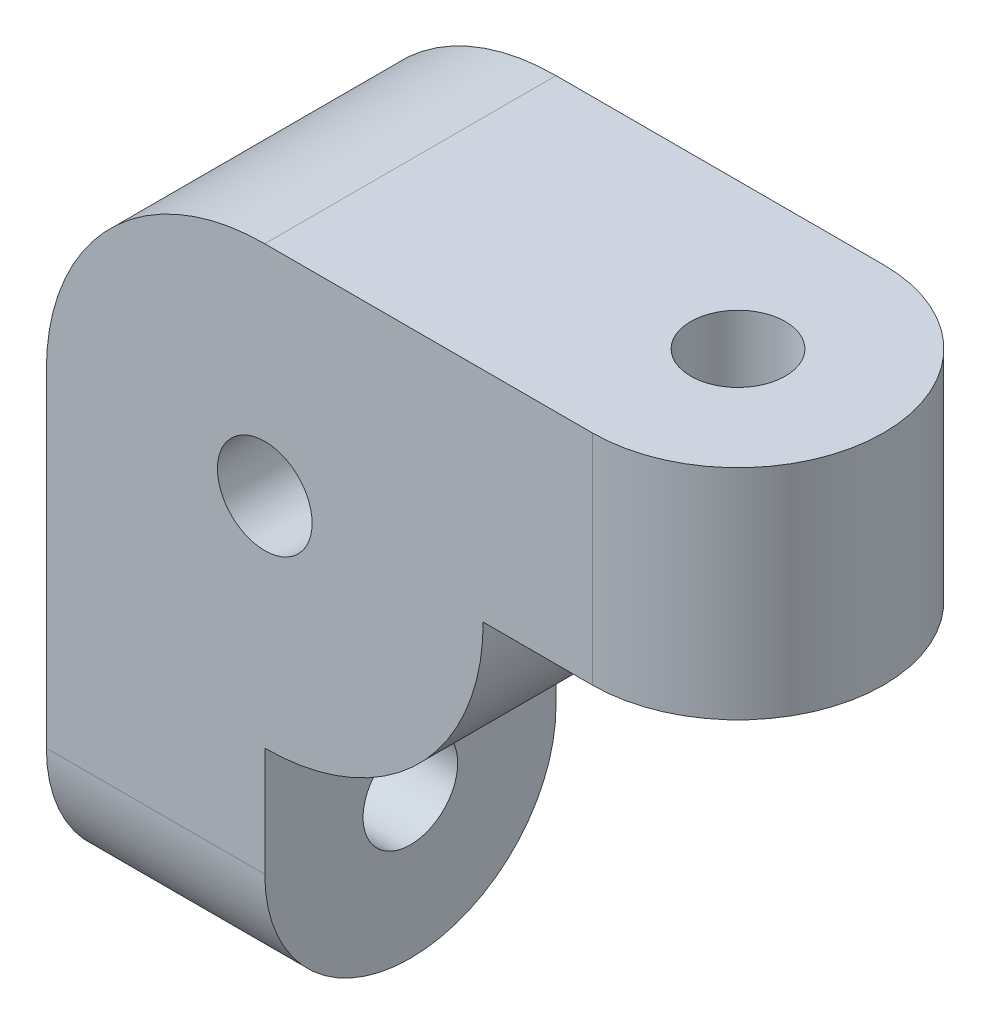
from build123d import *

# Parameters (mm, degrees)
SKETCH1_R           = 1.3
BOSS_EXTRUDE1_DEPTH = 8
BOSS_EXTRUDE2_DEPTH = 6
BOSS_EXTRUDE4_DEPTH = 6
SKETCH12_R          = 1.3
CUT_EXTRUDE6_DEPTH  = 6
SKETCH13_R          = 1.3
CUT_EXTRUDE7_DEPTH  = 6
SKETCH14_R          = 3
CUT_EXTRUDE8_DEPTH  = 3


with BuildPart() as part:
    # Sketch1 → Boss-Extrude1 (new body)
    with BuildSketch(Plane.XY):
        with BuildLine():
            Line((-6, -6), (0, -6))
            ThreePointArc((0, -6), (4.242640687, -4.242640687), (6, 0))
            Line((6, 0), (6, 6))
            Line((6, 6), (0, 6))
            ThreePointArc((0, 6), (-4.242640687, 4.242640687), (-6, 0))
            Line((-6, 0), (-6, -6))
        make_face()
        Circle(SKETCH1_R, mode=Mode.SUBTRACT)
    extrude(amount=BOSS_EXTRUDE1_DEPTH)

    # Sketch4 → Boss-Extrude2 (add)
    with BuildSketch(Plane(origin=(0, 0, 0), x_dir=(0, 0, -1), z_dir=(1, 0, 0))):
        with BuildLine():
            Line((-8, -6), (-8, -9))
            ThreePointArc((-8, -9), (-4, -13), (0, -9))
            Line((0, -9), (0, -6))
            Line((0, -6), (-8, -6))
        make_face()
    extrude(amount=-BOSS_EXTRUDE2_DEPTH)

    # Sketch5 → Boss-Extrude4 (add)
    with BuildSketch(Plane(origin=(0, 0, 0), x_dir=(1, 0, 0), z_dir=(0, 1, 0))):
        with BuildLine():
            Line((6, 0), (9, 0))
            ThreePointArc((9, 0), (13, -4), (9, -8))
            Line((9, -8), (6, -8))
            Line((6, -8), (6, 0))
        make_face()
    extrude(amount=BOSS_EXTRUDE4_DEPTH)

    # Sketch12 → Cut-Extrude6 (cut)
    with BuildSketch(Plane.XZ):
        with Locations((9, 4)):
            Circle(SKETCH12_R)
    extrude(amount=-CUT_EXTRUDE6_DEPTH, mode=Mode.SUBTRACT)

    # Sketch13 → Cut-Extrude7 (cut)
    with BuildSketch(Plane(origin=(0, 0, 0), x_dir=(0, 0, -1), z_dir=(1, 0, 0))):
        with Locations((-4, -9)):
            Circle(SKETCH13_R)
    extrude(amount=-CUT_EXTRUDE7_DEPTH, mode=Mode.SUBTRACT)

    # Sketch14 → Cut-Extrude8 (cut)
    with BuildSketch(Plane(origin=(0, 0, 0), x_dir=(-1, 0, 0), z_dir=(0, 0, -1))):
        Circle(SKETCH14_R)
    extrude(amount=-CUT_EXTRUDE8_DEPTH, mode=Mode.SUBTRACT)


solid = part.part
